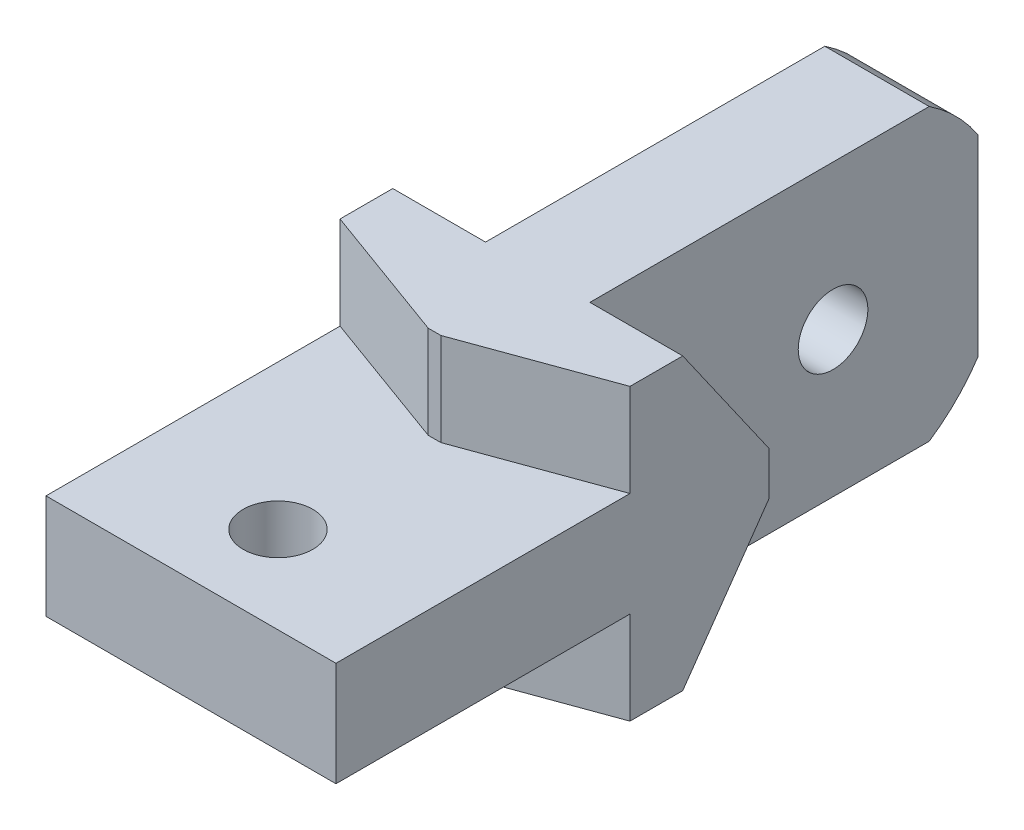
from build123d import *

# Parameters (mm, degrees)
SKETCH_1_W               = 25
SKETCH_1_H               = 25
EXTRUDE_1_DEPTH          = 68.359061336
SKETCH_2_W               = 25
SKETCH_2_H               = 8
CUT_EXTRUDE_3_DEPTH      = 26
CUT_EXTRUDE_START        = -17
SKETCH_4_R               = 3
CUT_EXTRUDE_4_DEPTH      = 57
MOVE_BODY_1_ANGLE        = 90
SKETCH_5_W               = 25
SKETCH_5_H               = 25
EXTRUDE_2_DEPTH          = 10
SKETCH_9_W               = 25
SKETCH_9_H               = 9
CUT_EXTRUDE_8_DEPTH      = 5
CUT_EXTRUDE_5_DEPTH      = 8
MIRROR_8_COPY_1_DEPTH    = 8
CUT_EXTRUDE_START_2      = 10
SKETCH_8_R               = 3
CUT_EXTRUDE_6_DEPTH      = 10
MIRROR_START             = 10
MIRROR_7_COPY_1_SKETCH_R = 3
MIRROR_7_COPY_1_DEPTH    = 10
CUT_EXTRUDE_9_DEPTH      = 10


# Read off the part's stored shape, not the designer's step: 교차1
with BuildPart() as part:
    # 스케치1 → 보스-돌출1 (new body)
    with BuildSketch(Plane.XY):
        Rectangle(SKETCH_1_W, SKETCH_1_H)
    extrude(amount=-EXTRUDE_1_DEPTH)

    # 스케치2 → 컷-돌출3 (cut)
    with BuildSketch(Plane(origin=(0, 0, -68.359061336), x_dir=(-1, 0, 0), z_dir=(0, 0, -1))):
        with Locations((0, 8.5)):
            Rectangle(SKETCH_2_W, SKETCH_2_H)
        with Locations((0, -8.5)):
            Rectangle(SKETCH_2_W, SKETCH_2_H)
    cut_extrude_3 = extrude(amount=-CUT_EXTRUDE_3_DEPTH, mode=Mode.SUBTRACT)

    # 스케치4 → 컷-돌출4 (cut)
    with BuildSketch(Plane.XZ.offset(-4.5).offset(CUT_EXTRUDE_START)):
        with Locations(Location((0, -55.859061336, 0), (0, 0, 90))):
            Circle(SKETCH_4_R)
    cut_extrude_4 = extrude(amount=CUT_EXTRUDE_4_DEPTH, mode=Mode.SUBTRACT)

    # 대칭 복사4: 컷-돌출3, 컷-돌출4 across plane
    add(cut_extrude_3.mirror(Plane.XY.offset(-34.179530668)), mode=Mode.SUBTRACT)
    add(cut_extrude_4.mirror(Plane.XY.offset(-34.179530668)), mode=Mode.SUBTRACT)


with BuildPart() as body_2:
    # 교차1: the piece on the far side of the plane
    add(part.part)
    split(bisect_by=Plane.XY.offset(-34.179530668), keep=Keep.BOTTOM)


with BuildPart() as part_1:
    add(part.part)

    # 교차1
    split(bisect_by=Plane.XY.offset(-34.179530668), keep=Keep.TOP)



with BuildPart() as body_2_1:
    # Move Body 1: moved
    add(body_2.part.rotate(Axis((0, 0, 0), (0, 0, 1)), MOVE_BODY_1_ANGLE))


with BuildPart() as part_2:
    add(part_1.part)

    add(body_2_1.part)  # 보스-돌출2 merges body 2
    # 스케치5 → 보스-돌출2 (add)
    with BuildSketch(Plane(origin=(0, 0, -42.359061336), x_dir=(-1, 0, 0), z_dir=(0, 0, -1))):
        Rectangle(SKETCH_5_W, SKETCH_5_H)
    extrude(amount=-EXTRUDE_2_DEPTH)

    # 스케치9 → 컷-돌출8 (cut)
    with BuildSketch(Plane.XY):
        Rectangle(SKETCH_9_W, SKETCH_9_H)
    extrude(amount=-CUT_EXTRUDE_8_DEPTH, mode=Mode.SUBTRACT)

    # 스케치7 → 컷-돌출5 (cut)
    with BuildSketch(Plane(origin=(-8, 4.5, 0), x_dir=(0, 0, 1), z_dir=(0, -1, 0))):
        Polygon((7.793639977, -63.756317597), (-41.547874973, 71.808380572), (-55.762350506, 74.314776125), (-6.420835555, -61.249922044), align=None)
    cut_extrude_5 = extrude(amount=-CUT_EXTRUDE_5_DEPTH, mode=Mode.SUBTRACT)

    # 대칭 복사5: 컷-돌출5 across plane
    add(cut_extrude_5.mirror(Plane(origin=(0, 0, 0), x_dir=(0, 0, 1), z_dir=(1, 0, 0))), mode=Mode.SUBTRACT)

    # 대칭 복사8: 컷-돌출5 across plane
    add(cut_extrude_5.mirror(Plane(origin=(0, 0, 0), x_dir=(0, 0, 1), z_dir=(0, -1, 0))), mode=Mode.SUBTRACT)

    # 대칭 복사8 copy 1 sketch → 대칭 복사8 copy 1 (cut)
    with BuildSketch(Plane(origin=(8, -4.5, 0), x_dir=(0, 0, 1), z_dir=(0, 1, 0))):
        Polygon((7.793639977, -63.756317597), (-41.547874973, 71.808380572), (-55.762350506, 74.314776125), (-6.420835555, -61.249922044), align=None)
    extrude(amount=-MIRROR_8_COPY_1_DEPTH, mode=Mode.SUBTRACT)

    # 스케치8 → 컷-돌출6 (cut)
    with BuildSketch(Plane(origin=(-4.5, 0, 0), x_dir=(0, 1, 0), z_dir=(-1, 0, 0)).offset(CUT_EXTRUDE_START_2)):
        Polygon((26.984001119, 62.545716444), (-15.512472392, 32.789365343), (-26.984001119, 49.172406229), (15.512472392, 78.92875733), align=None)
        with Locations(Location((0, 55.859061336, 0), (0, 0, 270))):
            Circle(SKETCH_8_R, mode=Mode.SUBTRACT)
    cut_extrude_6 = extrude(amount=-CUT_EXTRUDE_6_DEPTH, mode=Mode.SUBTRACT)

    # 대칭 복사6: 컷-돌출6 across plane
    add(cut_extrude_6.mirror(Plane(origin=(0, 0, 0), x_dir=(0, 0, 1), z_dir=(1, 0, 0))), mode=Mode.SUBTRACT)

    # 대칭 복사7: 컷-돌출6 across plane
    add(cut_extrude_6.mirror(Plane.ZX), mode=Mode.SUBTRACT)

    # 대칭 복사7 copy 1 sketch → 대칭 복사7 copy 1 (cut)
    with BuildSketch(Plane(origin=(4.5, 0, 0), x_dir=(0, -1, 0), z_dir=(1, 0, 0)).offset(MIRROR_START)):
        Polygon((26.984001119, 62.545716444), (-15.512472392, 32.789365343), (-26.984001119, 49.172406229), (15.512472392, 78.92875733), align=None)
        with Locations(Location((0, 55.859061336, 0), (0, 0, 270))):
            Circle(MIRROR_7_COPY_1_SKETCH_R, mode=Mode.SUBTRACT)
    extrude(amount=-MIRROR_7_COPY_1_DEPTH, mode=Mode.SUBTRACT)

    # 스케치10 → 컷-돌출9 (cut)
    with BuildSketch(Plane.ZY.offset(4.5)):
        with BuildLine():
            Line((-64.150623312, 12.5), (-68.359061336, 12.5))
            Line((-68.359061336, 12.5), (-68.359061336, 8.291561976))
            ThreePointArc((-68.359061336, 8.291561976), (-66.465663054, 10.606601718), (-64.150623312, 12.5))
        make_face()
        with BuildLine():
            Line((-64.150623312, -12.5), (-68.359061336, -12.5))
            Line((-68.359061336, -12.5), (-68.359061336, -8.291561976))
            ThreePointArc((-68.359061336, -8.291561976), (-66.465663054, -10.606601718), (-64.150623312, -12.5))
        make_face()
    extrude(amount=-CUT_EXTRUDE_9_DEPTH, mode=Mode.SUBTRACT)


solid = part_2.part
